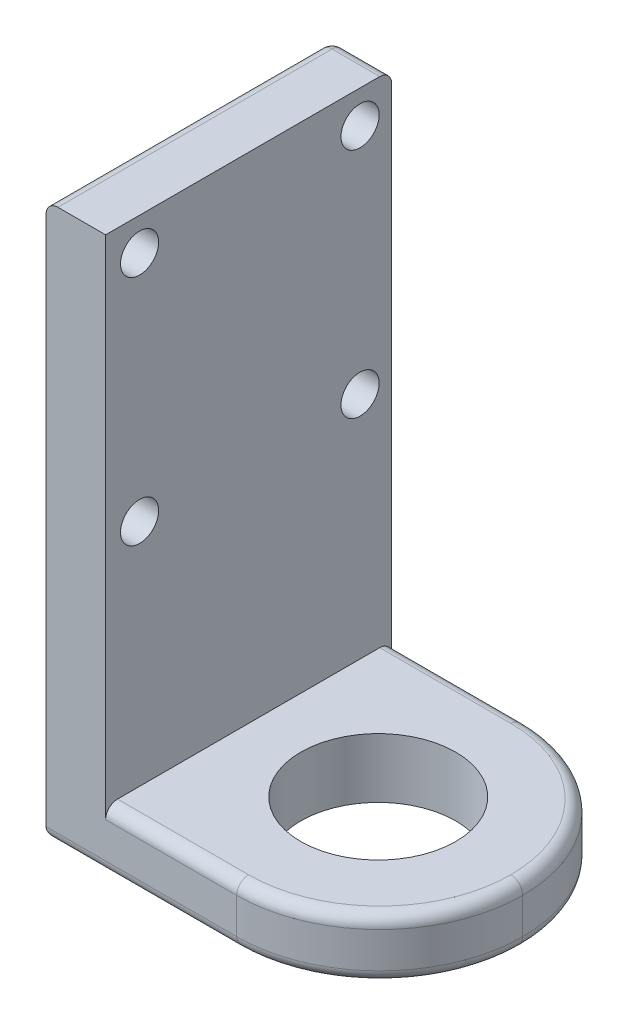
from build123d import *

# Parameters (mm, degrees)
CROQUIS1_W              = 24
CROQUIS1_H              = 46.5
CROQUIS1_R              = 1.6
SALIENTE_EXTRUIR1_DEPTH = 5
CROQUIS2_W              = 24
CROQUIS2_H              = 5
SALIENTE_EXTRUIR2_DEPTH = 23
CORTAR_EXTRUIR1_REACH   = 76.572
CROQUIS3_R              = 6.5
REDONDEO1_R             = 12
REDONDEO2_R             = 1
REDONDEO3_R             = 1


with BuildPart() as part:
    # Croquis1 → Saliente-Extruir1 (new body)
    with BuildSketch(Plane.ZY.offset(29.823119035)):
        with Locations((-34.755083615, 17.762616936)):
            Rectangle(CROQUIS1_W, CROQUIS1_H)
        with Locations((-44.105083615, 38.262616936)):
            Circle(CROQUIS1_R, mode=Mode.SUBTRACT)
        with Locations((-25.605083615, 38.262616936)):
            Circle(CROQUIS1_R, mode=Mode.SUBTRACT)
        with Locations((-25.605083615, 18.762616936)):
            Circle(CROQUIS1_R, mode=Mode.SUBTRACT)
        with Locations((-44.105083615, 18.762616936)):
            Circle(CROQUIS1_R, mode=Mode.SUBTRACT)
    extrude(amount=SALIENTE_EXTRUIR1_DEPTH)

    # Croquis2 → Saliente-Extruir2 (add)
    with BuildSketch(Plane(origin=(-29.823119035, 0, 0), x_dir=(0, 0, -1), z_dir=(1, 0, 0))):
        with Locations((34.755083615, -2.987383064)):
            Rectangle(CROQUIS2_W, CROQUIS2_H)
    extrude(amount=SALIENTE_EXTRUIR2_DEPTH)

    # Croquis3 → Cortar-Extruir1 (cut, up to next)
    with BuildSketch(Plane.XZ.offset(5.487383064), mode=Mode.PRIVATE) as cortar_extruir1_sk1:
        with Locations(Location((-19.047480384, -34.855083615, 0), (0, 0, 270))):
            Circle(CROQUIS3_R)
    cortar_extruir1_tool1 = extrude(cortar_extruir1_sk1.sketch, amount=-CORTAR_EXTRUIR1_REACH, mode=Mode.PRIVATE) & part.part
    add(cortar_extruir1_tool1.solids().sort_by_distance((-19.04748, -5.487383, -34.855084))[0], mode=Mode.SUBTRACT)

    # Redondeo1
    redondeo1_edges = [part.edges().sort_by_distance(p)[0] for p in [
        (-6.823119035, -2.987383064, -22.755083615),
        (-6.823119035, -2.987383064, -46.755083615),
    ]]
    fillet(redondeo1_edges, radius=REDONDEO1_R - 0.0001)  # a hair under: the kernel refuses the full size

    # Redondeo2
    redondeo2_edges = [part.edges().sort_by_distance(p)[0] for p in [
        (-26.823069035, -5.487383064, -22.755083615),
        (-10.337808371, -5.487383064, -26.269772952),
        (-10.337808371, -5.487383064, -43.240394279),
        (-24.323069035, -0.487383064, -22.755083615),
        (-10.337808371, -0.487383064, -26.269772952),
        (-10.337808371, -0.487383064, -43.240394279),
        (-34.823119035, -5.487383064, -34.755083615),
        (-34.823119035, 17.762616936, -46.755083615),
        (-26.823069035, -5.487383064, -46.755083615),
        (-24.323069035, -0.487383064, -46.755083615),
    ]]
    fillet(redondeo2_edges, radius=REDONDEO2_R)

    # Redondeo3
    redondeo3_edges = [part.edges().sort_by_distance(p)[0] for p in [
        (-31.823119035, 41.012616936, -46.755083615),
        (-34.823119035, 41.012616936, -34.255083615),
    ]]
    fillet(redondeo3_edges, radius=REDONDEO3_R)


solid = part.part
